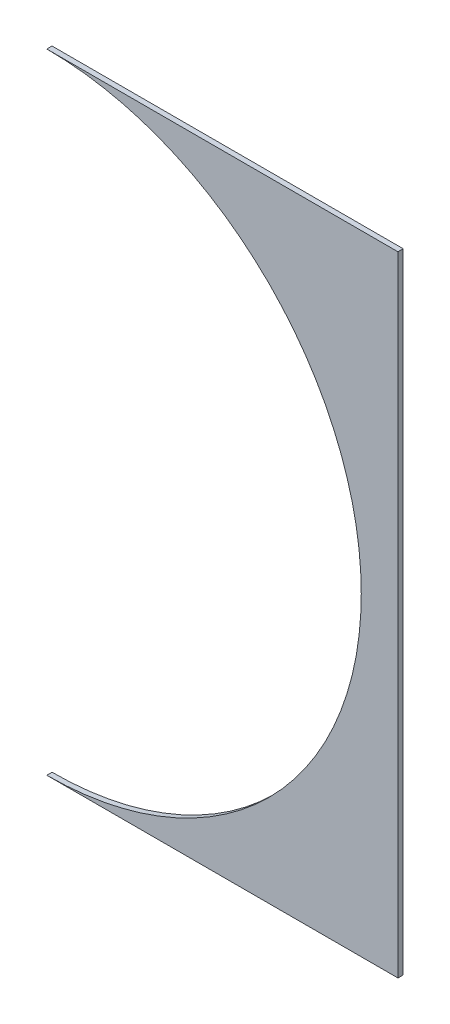
from build123d import *

# Parameters (mm, degrees)
BOSS_EXTRUDE1_DEPTH = 3.175


with BuildPart() as part:
    # Sketch1 → Boss-Extrude1 (new body)
    with BuildSketch(Plane.XY):
        with BuildLine():
            ThreePointArc((0, 381), (190.5, 190.5), (0, 0))
            Line((0, 0), (212.725, 0))
            Line((212.725, 0), (212.725, 381))
            Line((212.725, 381), (0, 381))
        make_face()
    extrude(amount=BOSS_EXTRUDE1_DEPTH)


solid = part.part
